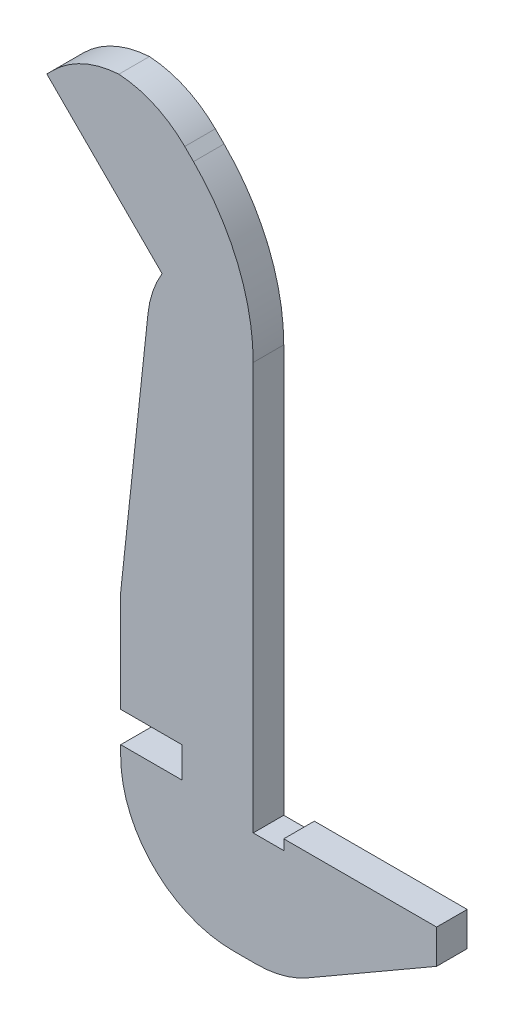
from build123d import *

# Parameters (mm, degrees)
BOSS_EXTRUDE1_DEPTH = 0.15
FILLET1_R           = 1.1
SKETCH2_W           = 0.6
SKETCH2_H           = 0.3
CUT_EXTRUDE1_DEPTH  = 7.86369632
FILLET2_R           = 2
FILLET3_R           = 1


with BuildPart() as part:
    # Sketch1 → Boss-Extrude1 (new, symmetric)
    with BuildSketch(Plane.XY):
        Polygon((0, 0), (-1.5, 0), (-1.5, -0.1), (-1.8, -0.1), (-1.8, 3.1), (-1.8, 3.517211082), (-1.8, 4.726345597), (-2.764644661, 5.690990258), (-3.471751442, 5.690990258), (-3.825304833, 5.337436867), (-2.693933983, 4.206066017), (-2.8, 4.1), (-3.1, 1.3), (-3.1, -1.2), (-2.8, -1.2), (-1.5, -1.2), (0, -0.333974596), align=None)
    extrude(amount=BOSS_EXTRUDE1_DEPTH, both=True)

    # Fillet1
    fillet1_edges = [part.edges().sort_by_distance(p)[0] for p in [
        (-3.1, -1.2, 0),
    ]]
    fillet(fillet1_edges, radius=FILLET1_R)

    # Sketch2 → Cut-Extrude1 (cut, through all)
    with BuildSketch(Plane.XY.offset(0.15)):
        with Locations((-2.8, 0.15)):
            Rectangle(SKETCH2_W, SKETCH2_H)
    extrude(amount=-CUT_EXTRUDE1_DEPTH, mode=Mode.SUBTRACT)

    # Fillet2
    fillet2_edges = [part.edges().sort_by_distance(p)[0] for p in [
        (-1.8, 4.726345597, 0),
    ]]
    fillet(fillet2_edges, radius=FILLET2_R)

    # Fillet3
    # the kernel refuses this fillet: 1 mm, written as the material it takes off along each edge
    with BuildSketch(Plane(origin=(-2.8, 4.1, -0.917160411), x_dir=(0.7071067811865565, 0.7071067811865387, 0), z_dir=(0, 0, 1))) as fillet3_piece_1:
        with BuildLine():
            CenterArc((0.388885384, -0.971047771), FILLET3_R, 103.820764191, 25.063732242)
            Line((-0.238867067, -0.192634731), (-0.251422116, -0.177066471))
            Line((-0.251422116, -0.177066471), (-0.012555049, 0.015568261))
            Line((-0.012555049, 0.015568261), (0, 0.02))
            ThreePointArc((0, 0.02), (0.075, 0.02), (0.145222292, 0.019420955))
            Line((0.145222292, 0.019420955), (0.15, 0))
        make_face()
    extrude(amount=1.834320821, mode=Mode.SUBTRACT)
    with BuildSketch(Plane(origin=(-1.5, -1.2, 0.819872981), x_dir=(0.8660254037844393, 0.49999999999999883, 0), z_dir=(0, 0, -1))) as fillet3_piece_2:
        with BuildLine():
            CenterArc((FILLET3_R * 0.267949192431, -FILLET3_R), FILLET3_R, 90, 30)
            Line((-FILLET3_R * 0.232050807569, -FILLET3_R * 0.133974596216), (-FILLET3_R * 0.242050807569, -FILLET3_R * 0.11665408814))
            Line((-FILLET3_R * 0.242050807569, -FILLET3_R * 0.11665408814), (-FILLET3_R * 0.00535898384862, FILLET3_R * 0.02))
            Line((-FILLET3_R * 0.00535898384862, FILLET3_R * 0.02), (FILLET3_R * 0.267949192431, FILLET3_R * 0.02))
            Line((FILLET3_R * 0.267949192431, FILLET3_R * 0.02), (FILLET3_R * 0.267949192431, 0))
        make_face()
    extrude(amount=1.639745962, mode=Mode.SUBTRACT)
    with BuildSketch(Plane(origin=(-3.471751442, 5.690990258, -1.185533906), x_dir=(1, 0, 0), z_dir=(0, 0, 1)), Plane(origin=(-2.764644661, 5.690990258, -1.185533906), x_dir=(0.7071067811865444, -0.7071067811865508, 0), z_dir=(0, 0, 1))) as fillet3_piece_3:
        with BuildLine():
            CenterArc((FILLET3_R * 0.414213562373, -FILLET3_R), FILLET3_R, 90, 45)
            Line((-FILLET3_R * 0.292893218813, -FILLET3_R * 0.292893218813), (-FILLET3_R * 0.307035354437, -FILLET3_R * 0.27875108319))
            Line((-FILLET3_R * 0.307035354437, -FILLET3_R * 0.27875108319), (-FILLET3_R * 0.00828427124746, FILLET3_R * 0.02))
            Line((-FILLET3_R * 0.00828427124746, FILLET3_R * 0.02), (FILLET3_R * 0.414213562373, FILLET3_R * 0.02))
            Line((FILLET3_R * 0.414213562373, FILLET3_R * 0.02), (FILLET3_R * 0.414213562373, 0))
        make_face()
    extrude(amount=2.371067812, mode=Mode.SUBTRACT)


solid = part.part
